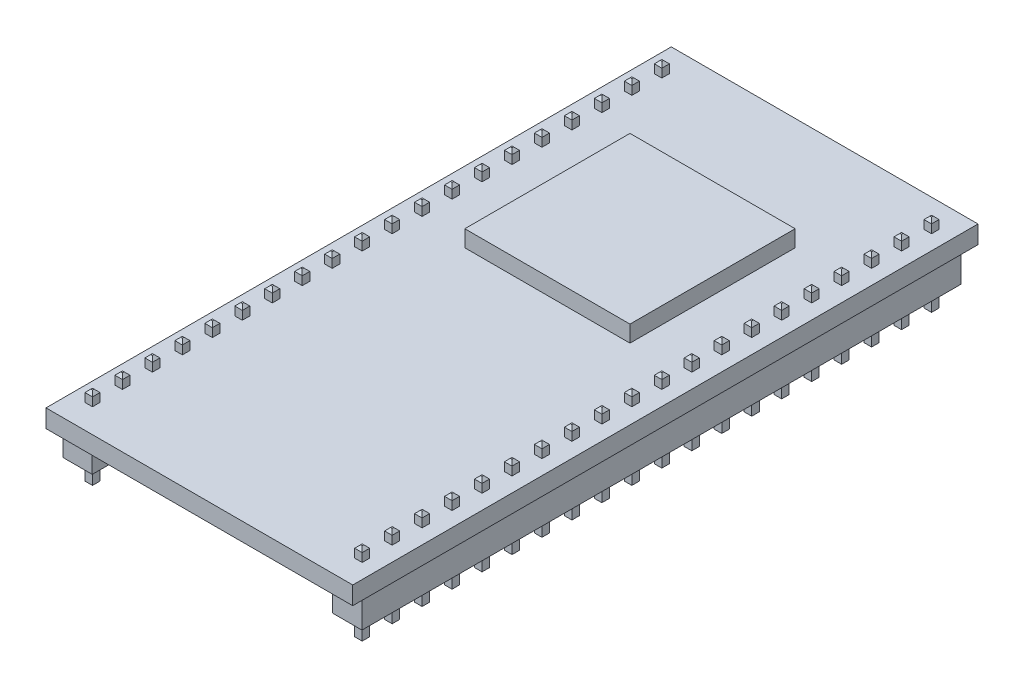
from build123d import *

# Parameters (mm, degrees)
SKETCH1_W                  = 26
SKETCH1_H                  = 53
BOSS_EXTRUDE1_DEPTH        = 1.524
SKETCH2_W                  = 2.5
SKETCH2_H                  = 50.8
BOSS_EXTRUDE2_DEPTH        = 2.5
BOSS_EXTRUDE3_START        = -5
SKETCH3_W                  = 0.64
SKETCH3_H                  = 0.64
BOSS_EXTRUDE3_DEPTH        = 7
CHAMFER1_SIZE              = 0.25
LPATTERN1_COUNT            = 20
LPATTERN1_PITCH            = 2.54
CHAMFER1_OF_LPATTERN1_SIZE = 0.25
SKETCH4_W                  = 14
SKETCH4_H                  = 14
BOSS_EXTRUDE4_DEPTH        = 1.4


# Read off the part's stored shape, not the designer's step: Mirror1
with BuildPart() as part:
    # Sketch1 → Boss-Extrude1 (new body)
    with BuildSketch(Plane(origin=(0, 0, 0), x_dir=(1, 0, 0), z_dir=(0, 1, 0))):
        Rectangle(SKETCH1_W, SKETCH1_H)
    extrude(amount=BOSS_EXTRUDE1_DEPTH)

    # Sketch2 → Boss-Extrude2 (add)
    with BuildSketch(Plane.XZ):
        with Locations((11.43, 0)):
            Rectangle(SKETCH2_W, SKETCH2_H)
    extrude(amount=BOSS_EXTRUDE2_DEPTH)

    # Sketch3 → Boss-Extrude3 (add)
    with BuildSketch(Plane.XZ.offset(2.5).offset(BOSS_EXTRUDE3_START)):
        with Locations((11.43, 24.13)):
            Rectangle(SKETCH3_W, SKETCH3_H)
    boss_extrude3 = extrude(amount=BOSS_EXTRUDE3_DEPTH)

    # Chamfer1
    chamfer1_edges = [part.edges().sort_by_distance(p)[0] for p in [
        (11.75, 2.5, 24.13),
        (11.43, 2.5, 23.81),
        (11.11, 2.5, 24.13),
        (11.43, 2.5, 24.45),
        (11.75, -4.5, 24.13),
        (11.43, -4.5, 24.45),
        (11.11, -4.5, 24.13),
        (11.43, -4.5, 23.81),
    ]]
    chamfer(chamfer1_edges, length=CHAMFER1_SIZE)

    # LPattern1: Boss-Extrude3 ×20
    with Locations(*[(0, 0, -i * LPATTERN1_PITCH) for i in range(1, LPATTERN1_COUNT)]):
        add(boss_extrude3)

    # Chamfer1 of LPattern1
    chamfer1_of_lpattern1_edges = [part.edges().sort_by_distance(p)[0] for p in [
        (11.75, 2.5, 21.59),
        (11.43, 2.5, 21.27),
        (11.11, 2.5, 21.59),
        (11.43, 2.5, 21.91),
        (11.75, -4.5, 21.59),
        (11.43, -4.5, 21.91),
        (11.11, -4.5, 21.59),
        (11.43, -4.5, 21.27),
        (11.75, 2.5, 19.05),
        (11.43, 2.5, 18.73),
        (11.11, 2.5, 19.05),
        (11.43, 2.5, 19.37),
        (11.75, -4.5, 19.05),
        (11.43, -4.5, 19.37),
        (11.11, -4.5, 19.05),
        (11.43, -4.5, 18.73),
        (11.75, 2.5, 16.51),
        (11.43, 2.5, 16.19),
        (11.11, 2.5, 16.51),
        (11.43, 2.5, 16.83),
        (11.75, -4.5, 16.51),
        (11.43, -4.5, 16.83),
        (11.11, -4.5, 16.51),
        (11.43, -4.5, 16.19),
        (11.75, 2.5, 13.97),
        (11.43, 2.5, 13.65),
        (11.11, 2.5, 13.97),
        (11.43, 2.5, 14.29),
        (11.75, -4.5, 13.97),
        (11.43, -4.5, 14.29),
        (11.11, -4.5, 13.97),
        (11.43, -4.5, 13.65),
        (11.75, 2.5, 11.43),
        (11.43, 2.5, 11.11),
        (11.11, 2.5, 11.43),
        (11.43, 2.5, 11.75),
        (11.75, -4.5, 11.43),
        (11.43, -4.5, 11.75),
        (11.11, -4.5, 11.43),
        (11.43, -4.5, 11.11),
        (11.75, 2.5, 8.89),
        (11.43, 2.5, 8.57),
        (11.11, 2.5, 8.89),
        (11.43, 2.5, 9.21),
        (11.75, -4.5, 8.89),
        (11.43, -4.5, 9.21),
        (11.11, -4.5, 8.89),
        (11.43, -4.5, 8.57),
        (11.75, 2.5, 6.35),
        (11.43, 2.5, 6.03),
        (11.11, 2.5, 6.35),
        (11.43, 2.5, 6.67),
        (11.75, -4.5, 6.35),
        (11.43, -4.5, 6.67),
        (11.11, -4.5, 6.35),
        (11.43, -4.5, 6.03),
        (11.75, 2.5, 3.81),
        (11.43, 2.5, 3.49),
        (11.11, 2.5, 3.81),
        (11.43, 2.5, 4.13),
        (11.75, -4.5, 3.81),
        (11.43, -4.5, 4.13),
        (11.11, -4.5, 3.81),
        (11.43, -4.5, 3.49),
        (11.75, 2.5, 1.27),
        (11.43, 2.5, 0.95),
        (11.11, 2.5, 1.27),
        (11.43, 2.5, 1.59),
        (11.75, -4.5, 1.27),
        (11.43, -4.5, 1.59),
        (11.11, -4.5, 1.27),
        (11.43, -4.5, 0.95),
        (11.75, 2.5, -1.27),
        (11.43, 2.5, -1.59),
        (11.11, 2.5, -1.27),
        (11.43, 2.5, -0.95),
        (11.75, -4.5, -1.27),
        (11.43, -4.5, -0.95),
        (11.11, -4.5, -1.27),
        (11.43, -4.5, -1.59),
        (11.75, 2.5, -3.81),
        (11.43, 2.5, -4.13),
        (11.11, 2.5, -3.81),
        (11.43, 2.5, -3.49),
        (11.75, -4.5, -3.81),
        (11.43, -4.5, -3.49),
        (11.11, -4.5, -3.81),
        (11.43, -4.5, -4.13),
        (11.75, 2.5, -6.35),
        (11.43, 2.5, -6.67),
        (11.11, 2.5, -6.35),
        (11.43, 2.5, -6.03),
        (11.75, -4.5, -6.35),
        (11.43, -4.5, -6.03),
        (11.11, -4.5, -6.35),
        (11.43, -4.5, -6.67),
        (11.75, 2.5, -8.89),
        (11.43, 2.5, -9.21),
        (11.11, 2.5, -8.89),
        (11.43, 2.5, -8.57),
        (11.75, -4.5, -8.89),
        (11.43, -4.5, -8.57),
        (11.11, -4.5, -8.89),
        (11.43, -4.5, -9.21),
        (11.75, 2.5, -11.43),
        (11.43, 2.5, -11.75),
        (11.11, 2.5, -11.43),
        (11.43, 2.5, -11.11),
        (11.75, -4.5, -11.43),
        (11.43, -4.5, -11.11),
        (11.11, -4.5, -11.43),
        (11.43, -4.5, -11.75),
        (11.75, 2.5, -13.97),
        (11.43, 2.5, -14.29),
        (11.11, 2.5, -13.97),
        (11.43, 2.5, -13.65),
        (11.75, -4.5, -13.97),
        (11.43, -4.5, -13.65),
        (11.11, -4.5, -13.97),
        (11.43, -4.5, -14.29),
        (11.75, 2.5, -16.51),
        (11.43, 2.5, -16.83),
        (11.11, 2.5, -16.51),
        (11.43, 2.5, -16.19),
        (11.75, -4.5, -16.51),
        (11.43, -4.5, -16.19),
        (11.11, -4.5, -16.51),
        (11.43, -4.5, -16.83),
        (11.75, 2.5, -19.05),
        (11.43, 2.5, -19.37),
        (11.11, 2.5, -19.05),
        (11.43, 2.5, -18.73),
        (11.75, -4.5, -19.05),
        (11.43, -4.5, -18.73),
        (11.11, -4.5, -19.05),
        (11.43, -4.5, -19.37),
        (11.75, 2.5, -21.59),
        (11.43, 2.5, -21.91),
        (11.11, 2.5, -21.59),
        (11.43, 2.5, -21.27),
        (11.75, -4.5, -21.59),
        (11.43, -4.5, -21.27),
        (11.11, -4.5, -21.59),
        (11.43, -4.5, -21.91),
        (11.75, 2.5, -24.13),
        (11.43, 2.5, -24.45),
        (11.11, 2.5, -24.13),
        (11.43, 2.5, -23.81),
        (11.75, -4.5, -24.13),
        (11.43, -4.5, -23.81),
        (11.11, -4.5, -24.13),
        (11.43, -4.5, -24.45),
    ]]
    chamfer(chamfer1_of_lpattern1_edges, length=CHAMFER1_OF_LPATTERN1_SIZE)

    # Mirror1: part across plane


with BuildPart() as part_1:
    add(part.part)
    add(part.part.mirror(Plane(origin=(0, 0, 0), x_dir=(0, 0, 1), z_dir=(1, 0, 0))))

    # Sketch4 → Boss-Extrude4 (add)
    with BuildSketch(Plane(origin=(0, 1.524, 0), x_dir=(1, 0, 0), z_dir=(0, 1, 0))):
        with Locations((0, 10)):
            Rectangle(SKETCH4_W, SKETCH4_H)
    extrude(amount=BOSS_EXTRUDE4_DEPTH)


solid = part_1.part
